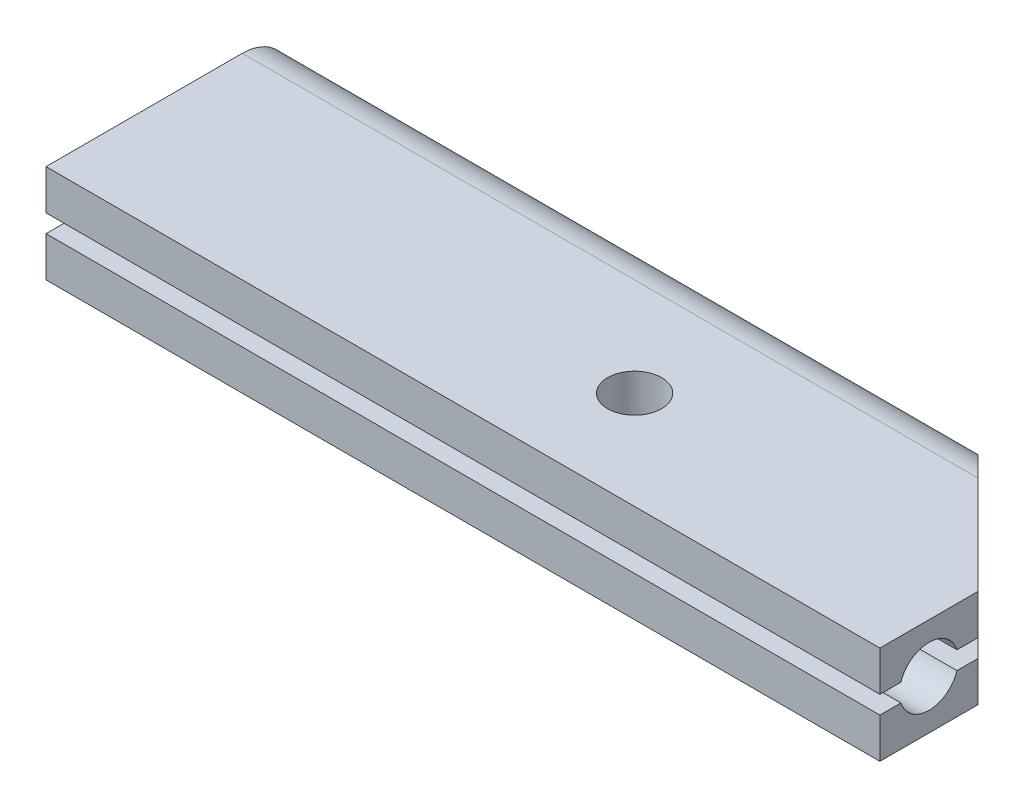
from build123d import *

# Parameters (mm, degrees)
EXTRUDE_1_DEPTH     = 2
SKETCH_2_R          = 0.6
CUT_EXTRUDE_1_DEPTH = 18.8325545
FILLET_1_R          = 1
SKETCH_3_W          = 8
SKETCH_3_H          = 0.367219666
CUT_EXTRUDE_2_DEPTH = 18.8325545
SKETCH_4_R          = 0.55
CUT_EXTRUDE_3_DEPTH = 18.8325545


with BuildPart() as part:
    # 草图1 → 凸台-拉伸1 (new body)
    with BuildSketch(Plane(origin=(0, 0, 0), x_dir=(1, 0, 0), z_dir=(0, 1, 0))):
        Polygon((17, 2), (14, 5), (0, 5), (0, 0), (17, 0), align=None)
    extrude(amount=EXTRUDE_1_DEPTH)

    # 草图2 → 切除-拉伸1 (cut, through all)
    with BuildSketch(Plane(origin=(17, 0, 0), x_dir=(0, 0, -1), z_dir=(1, 0, 0))):
        with Locations((1, 1)):
            Circle(SKETCH_2_R)
    extrude(amount=-CUT_EXTRUDE_1_DEPTH, mode=Mode.SUBTRACT)

    # 圆角1
    fillet_1_edges = [part.edges().sort_by_distance(p)[0] for p in [
        (7, 0, -5),
        (7, 2, -5),
    ]]
    fillet(fillet_1_edges, radius=FILLET_1_R - 0.0001)  # a hair under: the kernel refuses the full size

    # 草图3 → 切除-拉伸2 (cut, through all)
    with BuildSketch(Plane.ZY):
        with Locations((0, 1)):
            Rectangle(SKETCH_3_W, SKETCH_3_H)
    extrude(amount=-CUT_EXTRUDE_2_DEPTH, mode=Mode.SUBTRACT)

    # 草图4 → 切除-拉伸3 (cut, through all)
    with BuildSketch(Plane(origin=(0, 2, 0), x_dir=(1, 0, 0), z_dir=(0, 1, 0))):
        with Locations(Location((10, 2, 0), (0, 0, 270))):
            Circle(SKETCH_4_R)
    extrude(amount=-CUT_EXTRUDE_3_DEPTH, mode=Mode.SUBTRACT)


solid = part.part
